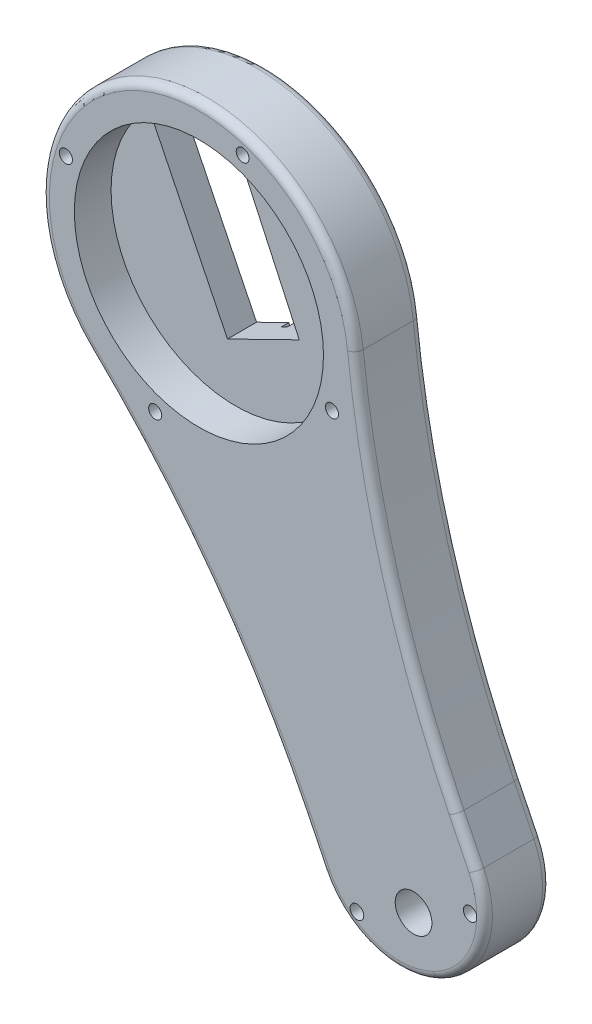
from build123d import *

# Parameters (mm, degrees)
SKETCH1_R                = 60
BOSS_EXTRUDE1_DEPTH      = 25.1
SKETCH3_R                = 47.5
CUT_EXTRUDE2_DEPTH       = 14
CUT_EXTRUDE5_DEPTH       = 89.487343728
CUT_EXTRUDE5_DEPTH_BACK  = 89.487343728
SKETCH2_R                = 2.494998654
SKETCH2_R_2              = 2.5
SKETCH2_R_3              = 2.444443829
SKETCH6_R                = 3
CUT_EXTRUDE6_DEPTH       = 6
CUT_EXTRUDE7_DEPTH       = 87
CUT_EXTRUDE7_DEPTH_BACK  = 87
BOSS_EXTRUDE2_DEPTH      = 130
BOSS_EXTRUDE2_DEPTH_BACK = 28
SKETCH8_W                = 65
SKETCH8_H                = 25.1
CUT_EXTRUDE9_DEPTH       = 3
FILLET6_R                = 32.5
FILLET7_R                = 400
FILLET8_R                = 3
CUT_EXTRUDE10_DEPTH      = 220.161234767
CUT_EXTRUDE10_DEPTH_BACK = 220.161234767
SKETCH14_R               = 2.6
CUT_EXTRUDE11_DEPTH      = 220.161234767
CUT_EXTRUDE11_DEPTH_BACK = 220.161234767
SKETCH15_R               = 7


with BuildPart() as part:
    # Sketch1 → Boss-Extrude1 (new body)
    with BuildSketch(Plane.XY):
        Circle(SKETCH1_R)
    extrude(amount=BOSS_EXTRUDE1_DEPTH)

    # Sketch3 → Cut-Extrude2 (cut)
    with BuildSketch(Plane.XY.offset(25.1)):
        Circle(SKETCH3_R)
    extrude(amount=-CUT_EXTRUDE2_DEPTH, mode=Mode.SUBTRACT)

    # Sketch2 → Cut-Extrude5 (cut, two sides: drawn at the far end of the back side and taken through both)
    with BuildSketch(Plane.XY.offset(25.1).offset(-CUT_EXTRUDE5_DEPTH_BACK)):
        with Locations((-16.664697145, -50.733104448)):
            Circle(SKETCH2_R)
        with Locations((-50.733105114, 16.664696544)):
            Circle(SKETCH2_R_2)
        with Locations((16.664695878, 50.733104512)):
            Circle(SKETCH2_R_3)
        with Locations((50.733103846, -16.66469648)):
            Circle(SKETCH2_R_2)
    extrude(amount=CUT_EXTRUDE5_DEPTH + CUT_EXTRUDE5_DEPTH_BACK, mode=Mode.SUBTRACT)

    # Sketch6 → Cut-Extrude6 (cut)
    with BuildSketch(Plane(origin=(0, 0, 0), x_dir=(-1, 0, 0), z_dir=(0, 0, -1))):
        with Locations((11.973502988, 47.212610548)):
            Circle(SKETCH6_R)
        with Locations((27.381285989, 40.029281029)):
            Circle(SKETCH6_R)
        with Locations((-19.717656658, -20.762902692)):
            Circle(SKETCH6_R)
        with Locations((-4.309873657, -27.946232212)):
            Circle(SKETCH6_R)
    extrude(amount=-CUT_EXTRUDE6_DEPTH, mode=Mode.SUBTRACT)

    # Sketch7 → Cut-Extrude7 (cut, two sides: drawn at the far end of the back side and taken through both)
    with BuildSketch(Plane.XY.offset(11.1).offset(-CUT_EXTRUDE7_DEPTH_BACK)):
        Polygon((-32.400942803, 32.871850778), (-3.10901045, -26.912408633), (24.254242539, -13.505492441), (-3.650778768, 46.958298756), align=None)
    extrude(amount=CUT_EXTRUDE7_DEPTH + CUT_EXTRUDE7_DEPTH_BACK, mode=Mode.SUBTRACT)

    # Sketch8 → Boss-Extrude2 (add, two sides: drawn at the far end of the back side and taken through both)
    with BuildSketch(Plane(origin=(33.53796733, -68.45033352, 0), x_dir=(-0.8980042769467113, -0.4399867254650012, 0), z_dir=(0.4399867254650012, -0.8980042769467113, 0)).offset(-BOSS_EXTRUDE2_DEPTH_BACK)):
        with Locations((0, -12.55)):
            Rectangle(SKETCH8_W, SKETCH8_H)
    extrude(amount=BOSS_EXTRUDE2_DEPTH + BOSS_EXTRUDE2_DEPTH_BACK)

    # Sketch12 → Cut-Extrude9 (cut)
    with BuildSketch(Plane(origin=(0, 0, 0), x_dir=(-1, 0, 0), z_dir=(0, 0, -1))):
        Polygon((16.569778792, 40.628497592), (19.583965842, 46.780394242), (22.182787305, 45.507074086), (19.168600256, 39.355177436), align=None)
        Polygon((-11.458078278, -19.775108918), (-14.390783054, -26.33846158), (-12.052056845, -27.383475291), (-9.156328603, -20.902875599), align=None)
    extrude(amount=-CUT_EXTRUDE9_DEPTH, mode=Mode.SUBTRACT)

    # Fillet6
    fillet6_edges = [part.edges().sort_by_distance(p)[0] for p in [
        (61.55110264, -199.490458101, 12.55),
        (119.921380641, -170.891320946, 12.55),
    ]]
    fillet(fillet6_edges, radius=FILLET6_R - 0.0001)  # a hair under: the kernel refuses the full size

    # Fillet7
    fillet7_edges = [part.edges().sort_by_distance(p)[0] for p in [
        (-6.994143408, -59.590955337, 12.55),
        (51.376134594, -30.991818182, 12.55),
    ]]
    fillet(fillet7_edges, radius=FILLET7_R)

    # Fillet8
    fillet8_edges = [part.edges().sort_by_distance(p)[0] for p in [
        (107.185043858, -166.531451726, 0),
        (65.91097186, -186.754121318, 0),
        (107.185043858, -166.531451726, 25.1),
        (65.91097186, -186.754121318, 25.1),
        (-26.399203528, 53.880256617, 0),
        (-26.399203528, 53.880256617, 25.1),
        (43.498358781, -162.645161964, 0),
        (43.498358781, -162.645161964, 25.1),
        (101.868636782, -134.046024809, 25.1),
        (101.868636782, -134.046024809, 0),
        (3.908005474, -95.532476324, 25.1),
        (3.908005474, -95.532476324, 0),
        (73.096748984, -61.632717183, 0),
        (73.096748984, -61.632717183, 25.1),
    ]]
    fillet(fillet8_edges, radius=FILLET8_R)

    # Sketch14 → Cut-Extrude10 (cut, two sides: drawn at the far end of the back side and taken through both)
    with BuildSketch(Plane.XY.offset(25.1).offset(-CUT_EXTRUDE10_DEPTH_BACK)):
        with Locations((60.257586661, -177.399828934)):
            Circle(SKETCH14_R)
        with BuildLine():
            ThreePointArc((105.912302046, -157.204623351), (105.933123865, -156.463342159), (105.935306185, -155.721771804))
            ThreePointArc((105.935306185, -155.721771804), (100.832398382, -156.384212323), (105.912302046, -157.204623351))
        make_face()
    extrude(amount=CUT_EXTRUDE10_DEPTH + CUT_EXTRUDE10_DEPTH_BACK, mode=Mode.SUBTRACT)

    # Sketch15 → Cut-Extrude11 (cut, two sides: drawn at the far end of the back side and taken through both)
    with BuildSketch(Plane.XY.offset(25.1).offset(-CUT_EXTRUDE11_DEPTH_BACK)):
        with Locations((81.844836116, -166.912185684)):
            Circle(SKETCH15_R)
    extrude(amount=CUT_EXTRUDE11_DEPTH + CUT_EXTRUDE11_DEPTH_BACK, mode=Mode.SUBTRACT)


solid = part.part
